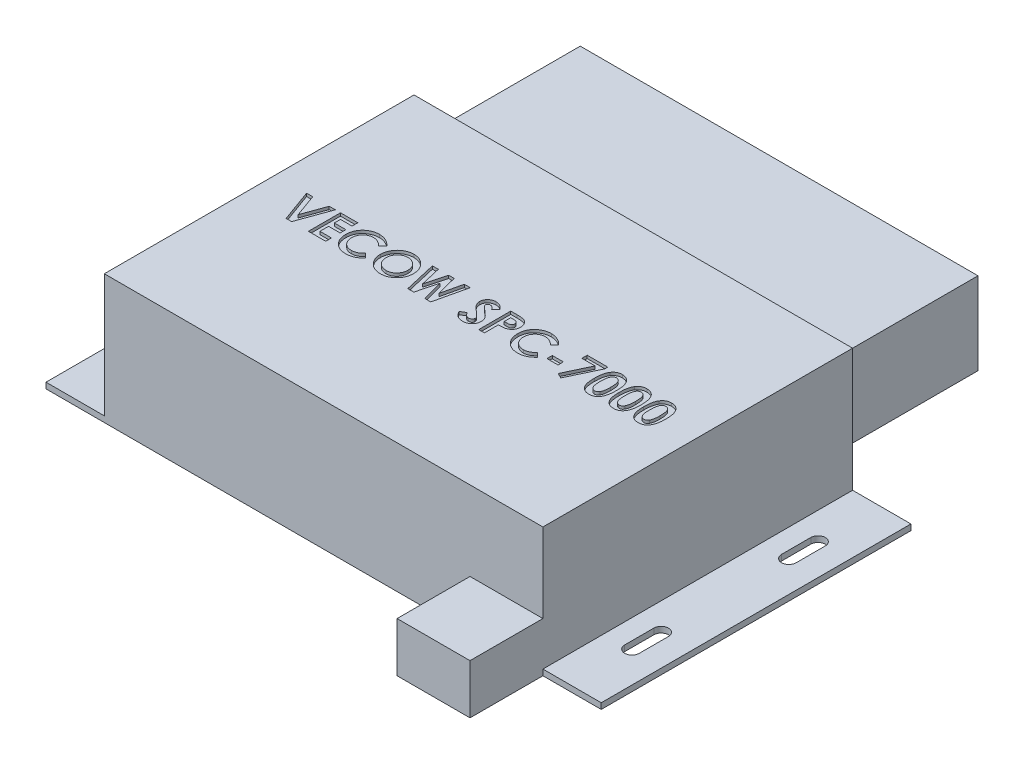
from build123d import *

# Parameters (mm, degrees)
SKETCH1_W           = 150.4
SKETCH1_H           = 106.2
BOSS_EXTRUDE1_DEPTH = 44.2
SKETCH2_W           = 106.2
SKETCH2_H           = 2
BOSS_EXTRUDE2_DEPTH = 20
CUT_EXTRUDE1_DEPTH  = 20
SKETCH4_W           = 3.807692308
SKETCH4_H           = 1.833333333
CUT_EXTRUDE2_DEPTH  = 1
SKETCH5_W           = 136.4
SKETCH5_H           = 28.2
BOSS_EXTRUDE3_DEPTH = 50
SKETCH6_W           = 25
SKETCH6_H           = 17
BOSS_EXTRUDE4_DEPTH = 25


with BuildPart() as part:
    # Sketch1 → Boss-Extrude1 (new body)
    with BuildSketch(Plane(origin=(0, 0, 0), x_dir=(1, 0, 0), z_dir=(0, 1, 0))):
        Rectangle(SKETCH1_W, SKETCH1_H)
    extrude(amount=BOSS_EXTRUDE1_DEPTH)

    # Sketch2 → Boss-Extrude2 (add)
    with BuildSketch(Plane(origin=(75.2, 0, 0), x_dir=(0, 0, -1), z_dir=(1, 0, 0))):
        with Locations((0, 1)):
            Rectangle(SKETCH2_W, SKETCH2_H)
    boss_extrude2 = extrude(amount=BOSS_EXTRUDE2_DEPTH)

    # Mirror1: Boss-Extrude2 across plane
    add(boss_extrude2.mirror(Plane(origin=(0, 0, 0), x_dir=(0, 0, 1), z_dir=(1, 0, 0))))

    # Sketch3 → Cut-Extrude1 (cut)
    with BuildSketch(Plane.XZ):
        with BuildLine():
            Line((-82.05, 31.9), (-82.05, 21.9))
            ThreePointArc((-82.05, 21.9), (-84.55, 19.4), (-87.05, 21.9))
            Line((-87.05, 21.9), (-87.05, 31.9))
            ThreePointArc((-87.05, 31.9), (-84.55, 34.4), (-82.05, 31.9))
        make_face()
        with BuildLine():
            Line((-82.05, -21.9), (-82.05, -31.9))
            ThreePointArc((-82.05, -31.9), (-84.55, -34.4), (-87.05, -31.9))
            Line((-87.05, -31.9), (-87.05, -21.9))
            ThreePointArc((-87.05, -21.9), (-84.55, -19.4), (-82.05, -21.9))
        make_face()
        with BuildLine():
            Line((87.05, 31.9), (87.05, 21.9))
            ThreePointArc((87.05, 21.9), (84.55, 19.4), (82.05, 21.9))
            Line((82.05, 21.9), (82.05, 31.9))
            ThreePointArc((82.05, 31.9), (84.55, 34.4), (87.05, 31.9))
        make_face()
        with BuildLine():
            Line((87.05, -21.9), (87.05, -31.9))
            ThreePointArc((87.05, -31.9), (84.55, -34.4), (82.05, -31.9))
            Line((82.05, -31.9), (82.05, -21.9))
            ThreePointArc((82.05, -21.9), (84.55, -19.4), (87.05, -21.9))
        make_face()
    extrude(amount=-CUT_EXTRUDE1_DEPTH, mode=Mode.SUBTRACT)

    # Sketch4 → Cut-Extrude2 (cut)
    # profile 1 of 13: a face of its own
    with BuildSketch(Plane(origin=(0, 44.2, 0), x_dir=(1, 0, 0), z_dir=(0, 1, 0))):
        Polygon((-64.448717949, 5.5), (-62.33994391, 5.5), (-59.512820513, -2.313701923), (-56.679086538, 5.5), (-54.576923077, 5.5), (-58.565304487, -5.5), (-60.466947115, -5.5), align=None)
    # profile 2 of 13: a face of its own
    with BuildSketch(Plane(origin=(0, 44.2, 0), x_dir=(1, 0, 0), z_dir=(0, 1, 0))):
        Polygon((-52.814102564, 5.5), (-46.891025641, 5.5), (-46.891025641, 3.525641026), (-50.83974359, 3.525641026), (-50.83974359, 1.41025641), (-46.891025641, 1.41025641), (-46.891025641, -0.564102564), (-50.83974359, -0.564102564), (-50.83974359, -3.525641026), (-46.891025641, -3.525641026), (-46.891025641, -5.5), (-52.814102564, -5.5), align=None)
    # profile 3 of 13: a face of its own
    with BuildSketch(Plane(origin=(0, 44.2, 0), x_dir=(1, 0, 0), z_dir=(0, 1, 0))):
        with BuildLine():
            Line((-35.044871795, 3.591746795), (-36.492588141, 2.207932692))
            add(Edge.make_bspline(
                [(-36.492588141, 2.207932692), (-36.615395236, 2.334915434), (-36.855275966, 2.582952511), (-37.241814096, 2.911331743), (-37.643799677, 3.184991401), (-38.053412882, 3.415465822), (-38.478021466, 3.589836148), (-38.912715796, 3.716902742), (-39.360271524, 3.794370441), (-39.663160026, 3.803234117), (-39.815504808, 3.807692308)],
                knots=[0, 0, 0, 0, 1.115251505, 2.178435587, 3.19620269, 4.182487026, 5.141301733, 6.088180966, 7.038406374, 8, 8, 8, 8], degree=3))
            add(Edge.make_bspline(
                [(-39.815504808, 3.807692308), (-39.942731214, 3.804170181), (-40.193798509, 3.797219652), (-40.56243109, 3.74626542), (-40.915047205, 3.659615531), (-41.252853916, 3.540195934), (-41.57485721, 3.385673312), (-41.881732208, 3.196167264), (-42.172722323, 2.973389298), (-42.443983744, 2.718492077), (-42.692124158, 2.439997709), (-42.911372014, 2.142844883), (-43.095027263, 1.827714358), (-43.245750138, 1.497797546), (-43.363157431, 1.151567429), (-43.44700099, 0.789257101), (-43.495493863, 0.41043508), (-43.50273175, 0.152914693), (-43.506410256, 0.022035256)],
                knots=[0, 0, 0, 0, 1.035432265, 2.043311493, 3.022114605, 3.98653278, 4.95457646, 5.923598177, 6.917315552, 7.932509744, 8.948865224, 9.949768934, 10.933144597, 11.912367597, 12.897413939, 13.903909035, 14.934704909, 16, 16, 16, 16], degree=3))
            add(Edge.make_bspline(
                [(-43.506410256, 0.022035256), (-43.505350153, -0.069825089), (-43.503260667, -0.250883719), (-43.480387545, -0.518719682), (-43.443556427, -0.778583886), (-43.390252673, -1.030082705), (-43.323595804, -1.273434091), (-43.24539212, -1.510737424), (-43.147286749, -1.738713706), (-43.038388306, -1.960010733), (-42.911740672, -2.168590139), (-42.77519116, -2.367487913), (-42.627125507, -2.555729078), (-42.466584685, -2.732544099), (-42.291309281, -2.895169753), (-42.105829515, -3.048496386), (-41.907016601, -3.188685713), (-41.699000387, -3.319255941), (-41.479983875, -3.432683409), (-41.255909491, -3.535426781), (-41.023379816, -3.618869676), (-40.785226039, -3.686132261), (-40.542299237, -3.743329044), (-40.29222336, -3.778546861), (-40.037166253, -3.805216901), (-39.86479046, -3.80686362), (-39.778044872, -3.807692308)],
                knots=[0, 0, 0, 0, 1.103660481, 2.175337485, 3.227646561, 4.255952547, 5.262355991, 6.258840057, 7.255597736, 8.242457506, 9.22035537, 10.185017736, 11.140346927, 12.096287581, 13.051739095, 14.01125915, 14.986044842, 15.97314143, 16.960198552, 17.947847494, 18.933482797, 19.925264591, 20.920966487, 21.929612487, 22.958107872, 24, 24, 24, 24], degree=3))
            add(Edge.make_bspline(
                [(-39.778044872, -3.807692308), (-39.630909447, -3.80343637), (-39.341826599, -3.79507456), (-38.917555952, -3.72968639), (-38.513268294, -3.622126549), (-38.190244389, -3.495104628), (-37.937163692, -3.369668831), (-37.744497099, -3.253646896), (-37.545264825, -3.123863624), (-37.342775949, -2.975420852), (-37.134752871, -2.810099954), (-36.924867679, -2.624280094), (-36.707747276, -2.424080053), (-36.565513851, -2.28119335), (-36.492588141, -2.207932692)],
                knots=[0, 0, 0, 0, 1.404581149, 2.759636711, 4.088442092, 5.392261763, 6.066678138, 6.783632037, 7.538459478, 8.336747902, 9.180226004, 10.074962426, 11.012997595, 12, 12, 12, 12], degree=3))
            Line((-36.492588141, -2.207932692), (-35.088942308, -3.682091346))
            add(Edge.make_bspline(
                [(-35.088942308, -3.682091346), (-35.187611055, -3.777352924), (-35.380191347, -3.96328315), (-35.670693373, -4.227286723), (-35.96082979, -4.46452328), (-36.243591508, -4.683603471), (-36.523610458, -4.878144956), (-36.800856944, -5.048342027), (-37.072192415, -5.198499214), (-37.34325124, -5.326084189), (-37.615720086, -5.434417085), (-37.896058509, -5.527684597), (-38.185123529, -5.606585556), (-38.484680625, -5.670248269), (-38.791935711, -5.72129717), (-39.109764285, -5.755754883), (-39.436151157, -5.778919656), (-39.657544429, -5.781001203), (-39.769230769, -5.782051282)],
                knots=[0, 0, 0, 0, 1.244526981, 2.429050516, 3.560637417, 4.644440555, 5.67424972, 6.652764056, 7.595344123, 8.486817594, 9.369275933, 10.254498637, 11.166417451, 12.086725134, 13.032340136, 13.991389299, 14.986715468, 16, 16, 16, 16], degree=3))
            add(Edge.make_bspline(
                [(-39.769230769, -5.782051282), (-39.974384742, -5.776821498), (-40.37581404, -5.766588265), (-40.964098209, -5.690766934), (-41.522952379, -5.563653809), (-42.053736136, -5.383880789), (-42.556280703, -5.154229181), (-43.030457516, -4.872687094), (-43.475502305, -4.54000254), (-43.887819985, -4.160074905), (-44.260780949, -3.740476727), (-44.590435251, -3.289943397), (-44.863125301, -2.806260707), (-45.089545726, -2.296574198), (-45.266603521, -1.75855797), (-45.391222192, -1.191630055), (-45.468073617, -0.596337857), (-45.476481272, -0.189739563), (-45.480769231, 0.017628205)],
                knots=[0, 0, 0, 0, 1.078019885, 2.10938526, 3.111377082, 4.085535484, 5.04941344, 6.010039228, 6.978205633, 7.964457913, 8.951525778, 9.924444315, 10.892603023, 11.863865945, 12.85144698, 13.863884204, 14.910567087, 16, 16, 16, 16], degree=3))
            add(Edge.make_bspline(
                [(-45.480769231, 0.017628205), (-45.478957347, 0.152871694), (-45.475366637, 0.420891234), (-45.43762794, 0.815705731), (-45.385018001, 1.200579245), (-45.301557117, 1.571515511), (-45.200953253, 1.933511728), (-45.075839131, 2.282633417), (-44.926414574, 2.61988399), (-44.757495889, 2.945828025), (-44.56639987, 3.258330239), (-44.352924639, 3.554705746), (-44.122565879, 3.83724251), (-43.869788447, 4.102192156), (-43.598265528, 4.351880994), (-43.306771228, 4.584955911), (-42.99705874, 4.804759466), (-42.668289787, 5.005623459), (-42.326851474, 5.187315616), (-41.977050236, 5.347575858), (-41.619745495, 5.481516516), (-41.256447967, 5.59261535), (-40.885622725, 5.675542775), (-40.509916625, 5.73831616), (-40.12613286, 5.773406884), (-39.868455309, 5.779151459), (-39.73838141, 5.782051282)],
                knots=[0, 0, 0, 0, 1.071919942, 2.124283339, 3.142214191, 4.149696895, 5.136002878, 6.119640489, 7.086990633, 8.058538607, 9.028339693, 9.988281803, 10.952401235, 11.916291999, 12.888973767, 13.874849856, 14.873389453, 15.898127285, 16.927174885, 17.938320013, 18.946391617, 19.950418109, 20.947802303, 21.956882652, 22.968648068, 24, 24, 24, 24], degree=3))
            add(Edge.make_bspline(
                [(-39.73838141, 5.782051282), (-39.627415038, 5.780389031), (-39.406636033, 5.777081812), (-39.077859048, 5.749512542), (-38.751711467, 5.706215282), (-38.429360999, 5.640888938), (-38.108501864, 5.563338311), (-37.79335051, 5.461796463), (-37.478935254, 5.348608938), (-37.170187233, 5.213316364), (-36.866675479, 5.065632298), (-36.575510235, 4.898079361), (-36.291802861, 4.720968575), (-36.021840143, 4.523817748), (-35.760565098, 4.313777905), (-35.509343957, 4.089869094), (-35.270381331, 3.848358097), (-35.120421655, 3.677716321), (-35.044871795, 3.591746795)],
                knots=[0, 0, 0, 0, 0.996412454, 1.982464992, 2.961075852, 3.949442424, 4.934965278, 5.923860011, 6.921385422, 7.934793307, 8.949617135, 9.951082467, 10.950285876, 11.951772932, 12.951063433, 13.960125323, 14.972308753, 16, 16, 16, 16], degree=3))
        make_face()
    # profile 4 of 13: a face of its own
    with BuildSketch(Plane(origin=(0, 44.2, 0), x_dir=(1, 0, 0), z_dir=(0, 1, 0))):
        with BuildLine():
            add(Edge.make_bspline(
                [(-27.901041667, 5.782051282), (-27.709793185, 5.777099516), (-27.332225367, 5.767323609), (-26.776959355, 5.685833795), (-26.241857885, 5.553057825), (-25.727162927, 5.368489624), (-25.234163219, 5.127130145), (-24.761119785, 4.83582209), (-24.309727044, 4.489067192), (-23.884610508, 4.094954672), (-23.491726158, 3.666374516), (-23.151291639, 3.204931782), (-22.86098157, 2.722582915), (-22.620371808, 2.218035447), (-22.437102689, 1.687795147), (-22.308495169, 1.134565539), (-22.225871208, 0.558504013), (-22.216368181, 0.166284631), (-22.211538462, -0.033052885)],
                knots=[0, 0, 0, 0, 1.014329547, 2.002516266, 2.970391464, 3.935626869, 4.897733899, 5.877609409, 6.878433252, 7.912639331, 8.949961323, 9.958554974, 10.949718813, 11.932905612, 12.9188844, 13.919928257, 14.942845884, 16, 16, 16, 16], degree=3))
            add(Edge.make_bspline(
                [(-22.211538462, -0.033052885), (-22.216681904, -0.230144327), (-22.226817223, -0.618519338), (-22.305122097, -1.18927223), (-22.435895385, -1.736575596), (-22.616056115, -2.261668269), (-22.852302125, -2.762006879), (-23.136950832, -3.24078602), (-23.477513572, -3.693562506), (-23.861568687, -4.12009336), (-24.284380038, -4.507261634), (-24.732204379, -4.848453007), (-25.202973934, -5.1375657), (-25.695999647, -5.374467287), (-26.212338788, -5.558317884), (-26.750715935, -5.688037839), (-27.311097775, -5.766871275), (-27.692184601, -5.776940391), (-27.885616987, -5.782051282)],
                knots=[0, 0, 0, 0, 1.051557043, 2.072126891, 3.067553643, 4.050577992, 5.02905126, 6.015227836, 7.017913613, 8.04756643, 9.074058332, 10.072836633, 11.047628519, 12.017157415, 12.98668631, 13.966869689, 14.968021931, 16, 16, 16, 16], degree=3))
            add(Edge.make_bspline(
                [(-27.885616987, -5.782051282), (-28.087924069, -5.777466561), (-28.485429833, -5.768458211), (-29.067181298, -5.682792916), (-29.624549469, -5.553751057), (-30.152852132, -5.361163004), (-30.657469599, -5.120411744), (-31.134694296, -4.823912134), (-31.584365846, -4.472154161), (-32.003904858, -4.074146479), (-32.384008219, -3.638638778), (-32.719523992, -3.178563512), (-33.00253899, -2.697435252), (-33.233063567, -2.19502882), (-33.414799883, -1.674466549), (-33.542994205, -1.132578064), (-33.61872165, -0.570663012), (-33.629270044, -0.188999076), (-33.634615385, 0.004407051)],
                knots=[0, 0, 0, 0, 1.067978421, 2.098431617, 3.099715153, 4.085208694, 5.062210972, 6.048429807, 7.046490867, 8.072918869, 9.098532598, 10.095778865, 11.076610158, 12.041847152, 13.011192615, 13.984257998, 14.978533688, 16, 16, 16, 16], degree=3))
            add(Edge.make_bspline(
                [(-33.634615385, 0.004407051), (-33.632937709, 0.134520569), (-33.6296036, 0.393100068), (-33.589440749, 0.776301686), (-33.53161779, 1.152023723), (-33.446100377, 1.51876817), (-33.342218579, 1.879122238), (-33.207625034, 2.229731663), (-33.054421156, 2.574341916), (-32.875416849, 2.90888272), (-32.676381368, 3.23027602), (-32.459215938, 3.537005747), (-32.223374498, 3.825363091), (-31.969616774, 4.097243016), (-31.69706828, 4.350858438), (-31.409314111, 4.589799634), (-31.100773511, 4.807719478), (-30.778199467, 5.009940006), (-30.443410576, 5.192804523), (-30.097769733, 5.348453331), (-29.748397822, 5.484378783), (-29.390627705, 5.59165716), (-29.028293527, 5.679034276), (-28.657524479, 5.736818263), (-28.28167025, 5.776980002), (-28.028218964, 5.780356844), (-27.901041667, 5.782051282)],
                knots=[0, 0, 0, 0, 1.034744296, 2.056386356, 3.06226378, 4.057406941, 5.050368692, 6.043467995, 7.042652155, 8.049140477, 9.059438543, 10.048523776, 11.036952808, 12.020949711, 13.004946614, 13.997082645, 14.994316842, 16.007702937, 17.024872941, 18.026463647, 19.021641123, 20.005082605, 20.995858141, 21.984425357, 22.988620895, 24, 24, 24, 24], degree=3))
        make_face()
        with BuildLine():
            add(Edge.make_bspline(
                [(-27.931891026, 3.807692308), (-28.060601228, 3.804238724), (-28.314623663, 3.797422732), (-28.687228313, 3.745494089), (-29.044941936, 3.662558145), (-29.385781583, 3.542426444), (-29.711224483, 3.389529277), (-30.021847546, 3.204400887), (-30.313349284, 2.980677691), (-30.589616592, 2.730370391), (-30.839178644, 2.451470535), (-31.05967459, 2.152581907), (-31.244194182, 1.834203647), (-31.398730496, 1.499293413), (-31.51506209, 1.144085228), (-31.597921597, 0.771361477), (-31.650285712, 0.380479937), (-31.656886274, 0.114016501), (-31.66025641, -0.022035256)],
                knots=[0, 0, 0, 0, 1.033739768, 2.040188636, 3.016340934, 3.979330865, 4.937572243, 5.900995986, 6.878200029, 7.884839167, 8.891893314, 9.879764717, 10.863503415, 11.843163062, 12.837761627, 13.859916423, 14.907309254, 16, 16, 16, 16], degree=3))
            add(Edge.make_bspline(
                [(-31.66025641, -0.022035256), (-31.655788124, -0.172811208), (-31.647031024, -0.46830709), (-31.585415004, -0.899368522), (-31.479996127, -1.306463262), (-31.327773318, -1.68760027), (-31.138977098, -2.047011787), (-30.904522158, -2.380292714), (-30.628205556, -2.689438582), (-30.415333485, -2.869930817), (-30.307291667, -2.961538462)],
                knots=[0, 0, 0, 0, 1.078454662, 2.113592447, 3.107694534, 4.079536787, 5.043276885, 6.005368276, 6.987637804, 8, 8, 8, 8], degree=3))
            add(Edge.make_bspline(
                [(-30.307291667, -2.961538462), (-30.218784791, -3.029214671), (-30.043765116, -3.163042334), (-29.764395608, -3.334569938), (-29.476700026, -3.481586206), (-29.178507345, -3.600373611), (-28.870447333, -3.693809787), (-28.552562235, -3.759241605), (-28.225302466, -3.800305729), (-28.003994073, -3.80521367), (-27.892227564, -3.807692308)],
                knots=[0, 0, 0, 0, 1.023928204, 2.024787132, 3.009472467, 3.9914905, 4.972207045, 5.96565515, 6.972602802, 8, 8, 8, 8], degree=3))
            add(Edge.make_bspline(
                [(-27.892227564, -3.807692308), (-27.765730537, -3.804209441), (-27.516843657, -3.797356792), (-27.151175243, -3.74606742), (-26.800853797, -3.659267284), (-26.463704493, -3.540189421), (-26.140699519, -3.385372498), (-25.833417487, -3.194502005), (-25.54131965, -2.969921588), (-25.265404304, -2.716327205), (-25.013204634, -2.436328676), (-24.793168818, -2.135845807), (-24.602782425, -1.821499135), (-24.451459696, -1.48883956), (-24.330532103, -1.141007231), (-24.248669853, -0.776461676), (-24.19586338, -0.396705688), (-24.189260958, -0.138268318), (-24.185897436, -0.006610577)],
                knots=[0, 0, 0, 0, 1.026359118, 2.019393844, 2.989460624, 3.950973911, 4.916101784, 5.890408035, 6.881132271, 7.902007068, 8.92769091, 9.933912415, 10.920395702, 11.90457117, 12.894218921, 13.903490204, 14.931958862, 16, 16, 16, 16], degree=3))
            add(Edge.make_bspline(
                [(-24.185897436, -0.006610577), (-24.189377337, 0.124290095), (-24.196226991, 0.381948105), (-24.247606635, 0.760727743), (-24.333856307, 1.123663937), (-24.453291749, 1.4713494), (-24.605804484, 1.804124994), (-24.794401953, 2.120820481), (-25.018422391, 2.421129696), (-25.272709981, 2.703006146), (-25.549486393, 2.962032547), (-25.846633528, 3.186820378), (-26.155836873, 3.382153855), (-26.484191063, 3.535170214), (-26.824978246, 3.657078022), (-27.180277923, 3.746852682), (-27.551435813, 3.79705793), (-27.8039422, 3.804115918), (-27.931891026, 3.807692308)],
                knots=[0, 0, 0, 0, 1.055025985, 2.07665775, 3.074803781, 4.057872707, 5.035505728, 6.020516407, 7.023567878, 8.050795229, 9.077271434, 10.074415901, 11.050397877, 12.019801805, 12.988065821, 13.964604439, 14.968634123, 16, 16, 16, 16], degree=3))
        make_face(mode=Mode.SUBTRACT)
    # profile 5 of 13: a face of its own
    with BuildSketch(Plane(origin=(0, 44.2, 0), x_dir=(1, 0, 0), z_dir=(0, 1, 0))):
        Polygon((-21.294871795, 5.5), (-19.256610577, 5.5), (-17.628205128, -1.522636218), (-15.76181891, 5.5), (-13.842548077, 5.5), (-11.987179487, -1.522636218), (-10.36318109, 5.5), (-8.320512821, 5.5), (-10.865584936, -5.5), (-12.928084936, -5.5), (-14.807692308, 1.610777244), (-16.698317308, -5.5), (-18.745392628, -5.5), align=None)
    # profile 6 of 13: a face of its own
    with BuildSketch(Plane(origin=(0, 44.2, 0), x_dir=(1, 0, 0), z_dir=(0, 1, 0))):
        with BuildLine():
            Line((3.314102564, 4.030248397), (1.837740385, 2.679487179))
            add(Edge.make_bspline(
                [(1.837740385, 2.679487179), (1.774499359, 2.76869522), (1.65308541, 2.939962218), (1.456286062, 3.169292765), (1.260375364, 3.364928788), (1.063538323, 3.52605301), (0.864030249, 3.651686482), (0.66219746, 3.740636368), (0.459184202, 3.797182654), (0.322790631, 3.804224028), (0.255608974, 3.807692308)],
                knots=[0, 0, 0, 0, 1.299362458, 2.494594718, 3.587462134, 4.587049575, 5.512617175, 6.380583204, 7.202344345, 8, 8, 8, 8], degree=3))
            add(Edge.make_bspline(
                [(0.255608974, 3.807692308), (0.192943852, 3.805494646), (0.071953965, 3.80125154), (-0.100526096, 3.759075374), (-0.25365635, 3.686285507), (-0.387287349, 3.591106632), (-0.493142816, 3.476438153), (-0.577660197, 3.356180403), (-0.625250585, 3.223443044), (-0.631514417, 3.132273671), (-0.634615385, 3.087139423)],
                knots=[0, 0, 0, 0, 1.185010067, 2.2879431, 3.333075148, 4.379039566, 5.372662701, 6.27520591, 7.14612461, 8, 8, 8, 8], degree=3))
            add(Edge.make_bspline(
                [(-0.634615385, 3.087139423), (-0.632672165, 3.041354319), (-0.628758791, 2.949149483), (-0.590960925, 2.814011813), (-0.533988747, 2.681966577), (-0.479549506, 2.601584359), (-0.451722756, 2.560496795)],
                knots=[0, 0, 0, 0, 0.967525499, 1.948461899, 2.951351359, 4, 4, 4, 4], degree=3))
            add(Edge.make_bspline(
                [(-0.451722756, 2.560496795), (-0.426425231, 2.528559861), (-0.368193669, 2.455045257), (-0.257158006, 2.338609584), (-0.117720532, 2.195965693), (0.055484599, 2.032018689), (0.255267167, 1.840872397), (0.490887351, 1.630040849), (0.755562975, 1.39299484), (0.943688277, 1.227924582), (1.042267628, 1.141426282)],
                knots=[0, 0, 0, 0, 0.473873513, 1.090794244, 1.870441696, 2.795289791, 3.865433203, 5.087734844, 6.473946851, 8, 8, 8, 8], degree=3))
            add(Edge.make_bspline(
                [(1.042267628, 1.141426282), (1.13479853, 1.061345454), (1.310402957, 0.90936868), (1.560253185, 0.693662051), (1.779829923, 0.499596056), (1.972331903, 0.330083211), (2.134840983, 0.183344938), (2.268040353, 0.05867983), (2.373556815, -0.041485113), (2.433536746, -0.1019848), (2.459134615, -0.127804487)],
                knots=[0, 0, 0, 0, 1.543621617, 2.929473131, 4.163658386, 5.240097082, 6.164993805, 6.925417477, 7.541396219, 8, 8, 8, 8], degree=3))
            add(Edge.make_bspline(
                [(2.459134615, -0.127804487), (2.556247595, -0.23290153), (2.742932847, -0.434934954), (2.985557863, -0.748023224), (3.1852461, -1.053661215), (3.339728706, -1.357600003), (3.456400184, -1.664224818), (3.538655121, -1.981055618), (3.587918151, -2.311403086), (3.593387497, -2.536824905), (3.596153846, -2.650841346)],
                knots=[0, 0, 0, 0, 1.206664779, 2.319633467, 3.337109185, 4.282041471, 5.190008762, 6.099243693, 7.03861361, 8, 8, 8, 8], degree=3))
            add(Edge.make_bspline(
                [(3.596153846, -2.650841346), (3.59418483, -2.761936385), (3.590321546, -2.979908986), (3.543003734, -3.298879419), (3.47553131, -3.604147967), (3.371207107, -3.892392876), (3.244057385, -4.1683456), (3.084656845, -4.427707671), (2.897462768, -4.67310394), (2.682909613, -4.900147649), (2.445588347, -5.106174078), (2.191038735, -5.289583671), (1.916771662, -5.441011652), (1.625130423, -5.565701793), (1.316271127, -5.661739808), (0.990561718, -5.732720851), (0.647504002, -5.775322554), (0.412916192, -5.779776056), (0.29306891, -5.782051282)],
                knots=[0, 0, 0, 0, 1.043214005, 2.046824704, 3.02475056, 3.976699089, 4.921714032, 5.875962561, 6.831408892, 7.817874052, 8.806269674, 9.781291748, 10.760897367, 11.74438705, 12.757449933, 13.795994037, 14.874007457, 16, 16, 16, 16], degree=3))
            add(Edge.make_bspline(
                [(0.29306891, -5.782051282), (0.198989814, -5.780382256), (0.01265925, -5.777076628), (-0.261963832, -5.750088924), (-0.527143461, -5.706533641), (-0.782580938, -5.64410591), (-1.029427053, -5.565001507), (-1.267691943, -5.46837851), (-1.495730787, -5.352739298), (-1.715269035, -5.220461872), (-1.92523946, -5.066870357), (-2.128297056, -4.895104881), (-2.322424861, -4.702523613), (-2.508555232, -4.489582001), (-2.685497255, -4.255677046), (-2.859042878, -4.004066307), (-3.021479211, -3.73008023), (-3.12182336, -3.537876781), (-3.173076923, -3.439703526)],
                knots=[0, 0, 0, 0, 1.016823716, 2.013894106, 2.979844003, 3.91962641, 4.853723003, 5.779685073, 6.695824784, 7.614987388, 8.547259901, 9.504950863, 10.487499108, 11.500346958, 12.559593716, 13.656357062, 14.802919212, 16, 16, 16, 16], degree=3))
            Line((-3.173076923, -3.439703526), (-1.436698718, -2.397435897))
            add(Edge.make_bspline(
                [(-1.436698718, -2.397435897), (-1.37258817, -2.508875369), (-1.249682771, -2.722514361), (-1.041408082, -3.009565424), (-0.828041296, -3.255377144), (-0.604649564, -3.455604782), (-0.373949245, -3.61292564), (-0.134826004, -3.72535804), (0.112888162, -3.794953568), (0.281619799, -3.803452789), (0.365785256, -3.807692308)],
                knots=[0, 0, 0, 0, 1.283663364, 2.460892379, 3.537111102, 4.529833553, 5.449777664, 6.316464042, 7.160231139, 8, 8, 8, 8], degree=3))
            add(Edge.make_bspline(
                [(0.365785256, -3.807692308), (0.451393577, -3.804230087), (0.617486186, -3.797512875), (0.854562131, -3.735468013), (1.071922335, -3.638053027), (1.259806889, -3.499055276), (1.418895684, -3.338630745), (1.536312346, -3.160151119), (1.610074285, -2.967040472), (1.617872711, -2.832893114), (1.621794872, -2.765424679)],
                knots=[0, 0, 0, 0, 1.13588714, 2.203786484, 3.234766741, 4.283437687, 5.291419208, 6.222934724, 7.106237994, 8, 8, 8, 8], degree=3))
            add(Edge.make_bspline(
                [(1.621794872, -2.765424679), (1.618172917, -2.702656281), (1.610815261, -2.575148287), (1.55662104, -2.385564404), (1.471898942, -2.196066741), (1.371666726, -2.04063563), (1.269667896, -1.910497374), (1.172134008, -1.797738463), (1.053363533, -1.673159606), (0.913657621, -1.536604093), (0.754862152, -1.386869792), (0.57684336, -1.223971364), (0.377562743, -1.04934375), (0.23671081, -0.930389145), (0.163060897, -0.868189103)],
                knots=[0, 0, 0, 0, 0.916159276, 1.861089862, 2.860218735, 3.940849679, 4.552606315, 5.27541173, 6.11797699, 7.06649574, 8.129236253, 9.306560635, 10.591630461, 12, 12, 12, 12], degree=3))
            add(Edge.make_bspline(
                [(0.163060897, -0.868189103), (0.023049483, -0.74972602), (-0.2456748, -0.522359508), (-0.625416304, -0.186546328), (-0.967597402, 0.127301859), (-1.269262648, 0.423064902), (-1.534255726, 0.695280745), (-1.760781987, 0.946160427), (-1.946352936, 1.177639143), (-2.141626346, 1.451810191), (-2.327175128, 1.785906452), (-2.48754193, 2.187862985), (-2.591581142, 2.589768516), (-2.603237289, 2.859585752), (-2.608974359, 2.992387821)],
                knots=[0, 0, 0, 0, 1.345494975, 2.582412109, 3.71882943, 4.751509156, 5.681369928, 6.505683931, 7.230279997, 7.856715994, 8.973648664, 10.023341002, 11.027102913, 12, 12, 12, 12], degree=3))
            add(Edge.make_bspline(
                [(-2.608974359, 2.992387821), (-2.606588319, 3.086563919), (-2.601887564, 3.272100951), (-2.559956107, 3.544906121), (-2.497287947, 3.808140189), (-2.406275786, 4.060842756), (-2.288152991, 4.302697302), (-2.144697445, 4.534887807), (-1.973681554, 4.755277242), (-1.780958191, 4.963719504), (-1.568626388, 5.154212011), (-1.341722872, 5.322340736), (-1.101531939, 5.464344701), (-0.849522953, 5.582147302), (-0.584134322, 5.67231771), (-0.30732115, 5.736234989), (-0.018686399, 5.774250948), (0.177636728, 5.779418777), (0.277644231, 5.782051282)],
                knots=[0, 0, 0, 0, 1.010766082, 1.991317756, 2.957454644, 3.913069143, 4.869106762, 5.843196583, 6.838735724, 7.860187025, 8.887984031, 9.89767229, 10.887916223, 11.879572884, 12.879850636, 13.892031539, 14.926195476, 16, 16, 16, 16], degree=3))
            add(Edge.make_bspline(
                [(0.277644231, 5.782051282), (0.407249005, 5.777310063), (0.665435498, 5.767865051), (1.047171675, 5.694008144), (1.420035612, 5.577860377), (1.72049636, 5.437740875), (1.959567369, 5.302007047), (2.142792965, 5.177040437), (2.329234872, 5.033884467), (2.520396627, 4.872088018), (2.712726149, 4.68860263), (2.911692287, 4.487796318), (3.114583883, 4.267933646), (3.246431251, 4.110864772), (3.314102564, 4.030248397)],
                knots=[0, 0, 0, 0, 1.282922637, 2.555718331, 3.837320111, 5.142675274, 5.830281639, 6.55870424, 7.337177975, 8.157850921, 9.037902056, 9.96903443, 10.957596896, 12, 12, 12, 12], degree=3))
        make_face()
    # profile 7 of 13: a face of its own
    with BuildSketch(Plane(origin=(0, 44.2, 0), x_dir=(1, 0, 0), z_dir=(0, 1, 0))):
        with BuildLine():
            Line((5.570512821, 5.5), (7.774038462, 5.5))
            add(Edge.make_bspline(
                [(7.774038462, 5.5), (7.918013968, 5.499355535), (8.1957729, 5.498112227), (8.596324132, 5.483035462), (8.965852255, 5.456016982), (9.304272372, 5.422626413), (9.611445331, 5.375814135), (9.887755807, 5.322147523), (10.133261139, 5.25676597), (10.350729766, 5.179158973), (10.545900834, 5.087663356), (10.730595613, 4.990213992), (10.90063998, 4.873911614), (11.064616588, 4.751290797), (11.213150613, 4.610637622), (11.355508495, 4.461312763), (11.485660989, 4.297394117), (11.604211175, 4.120865875), (11.711754461, 3.934989526), (11.80571147, 3.739432777), (11.881924134, 3.53388618), (11.945857082, 3.319679388), (11.99720865, 3.096821736), (12.031389887, 2.863942631), (12.054607504, 2.622668122), (12.056656138, 2.458456539), (12.057692308, 2.375400641)],
                knots=[0, 0, 0, 0, 1.698747864, 3.27724071, 4.728299578, 6.070144658, 7.288476769, 8.393259625, 9.389771311, 10.283485332, 11.113357557, 11.931608583, 12.74405601, 13.541433047, 14.344816069, 15.154114104, 15.974336324, 16.810834471, 17.661136416, 18.50621059, 19.367396281, 20.244825668, 21.142564693, 22.063065223, 23.020325768, 24, 24, 24, 24], degree=3))
            add(Edge.make_bspline(
                [(12.057692308, 2.375400641), (12.056193099, 2.283517879), (12.05324697, 2.102956961), (12.024365413, 1.838276807), (11.975026589, 1.585928243), (11.910543326, 1.343783171), (11.820626002, 1.115825411), (11.717899682, 0.896615824), (11.591513724, 0.692300371), (11.447097563, 0.500323314), (11.289378639, 0.319123788), (11.114612712, 0.153933587), (10.926130895, 0.003626614), (10.725024244, -0.133372358), (10.510537741, -0.256786973), (10.282826152, -0.367772877), (10.04033453, -0.462780397), (9.871470661, -0.512468561), (9.785857372, -0.537660256)],
                knots=[0, 0, 0, 0, 1.102006807, 2.165578795, 3.188629044, 4.184801286, 5.166646146, 6.124351954, 7.085497154, 8.042432466, 9.003981491, 9.963833307, 10.922997304, 11.89326795, 12.880200226, 13.889073926, 14.929769137, 16, 16, 16, 16], degree=3))
            add(Edge.make_bspline(
                [(9.785857372, -0.537660256), (9.729467535, -0.551690139), (9.607308989, -0.582083383), (9.405170148, -0.612940154), (9.172226358, -0.641311058), (8.907724358, -0.665692415), (8.611511657, -0.682266057), (8.283875067, -0.695209334), (7.924666107, -0.704620433), (7.674886401, -0.70495438), (7.544871795, -0.705128205)],
                knots=[0, 0, 0, 0, 0.618981996, 1.340914327, 2.176866532, 3.120127938, 4.170906482, 5.338178032, 6.614476169, 8, 8, 8, 8], degree=3))
            Line((7.544871795, -0.705128205), (7.544871795, -5.5))
            Line((7.544871795, -5.5), (5.570512821, -5.5))
            Line((5.570512821, -5.5), (5.570512821, 5.5))
        make_face()
        with BuildLine():
            Line((7.544871795, 1.269230769), (8.243389423, 1.269230769))
            add(Edge.make_bspline(
                [(8.243389423, 1.269230769), (8.370495734, 1.270036722), (8.604373233, 1.271519687), (8.923767308, 1.292964221), (9.18043853, 1.325714356), (9.383213562, 1.372685624), (9.543323655, 1.443970742), (9.681408587, 1.526434201), (9.799847559, 1.63070698), (9.902398275, 1.749856472), (9.984384483, 1.886765211), (10.041237648, 2.039203902), (10.078168345, 2.203969647), (10.081579238, 2.318635699), (10.083333333, 2.377604167)],
                knots=[0, 0, 0, 0, 1.8619151, 3.425951444, 4.686033666, 5.651700536, 6.461346321, 7.243864085, 7.999046032, 8.762387399, 9.539336099, 10.322741239, 11.137448474, 12, 12, 12, 12], degree=3))
            add(Edge.make_bspline(
                [(10.083333333, 2.377604167), (10.081597282, 2.429124149), (10.078228924, 2.529085301), (10.053484053, 2.673354038), (10.014047847, 2.807842263), (9.9569063, 2.931145423), (9.88303581, 3.043054007), (9.792972734, 3.14352393), (9.687872758, 3.234706841), (9.606729432, 3.282971348), (9.565504808, 3.307491987)],
                knots=[0, 0, 0, 0, 1.102301479, 2.1387299, 3.123554645, 4.094223062, 5.036071848, 5.982632524, 6.975082478, 8, 8, 8, 8], degree=3))
            add(Edge.make_bspline(
                [(9.565504808, 3.307491987), (9.530585171, 3.325151849), (9.456653144, 3.362541395), (9.330739735, 3.406009476), (9.185437584, 3.44267959), (9.019765737, 3.473115431), (8.834385107, 3.496736805), (8.629328769, 3.514801246), (8.404294963, 3.522065662), (8.247797416, 3.524416366), (8.166266026, 3.525641026)],
                knots=[0, 0, 0, 0, 0.656809284, 1.390599849, 2.23162475, 3.173112763, 4.218524733, 5.370385145, 6.63003504, 8, 8, 8, 8], degree=3))
            Line((8.166266026, 3.525641026), (7.544871795, 3.525641026))
            Line((7.544871795, 3.525641026), (7.544871795, 1.269230769))
        make_face(mode=Mode.SUBTRACT)
    # profile 8 of 13: a face of its own
    with BuildSketch(Plane(origin=(0, 44.2, 0), x_dir=(1, 0, 0), z_dir=(0, 1, 0))):
        with BuildLine():
            Line((23.903846154, 3.591746795), (22.456129808, 2.207932692))
            add(Edge.make_bspline(
                [(22.456129808, 2.207932692), (22.333322713, 2.334915434), (22.093441983, 2.582952511), (21.706903853, 2.911331743), (21.304918272, 3.184991401), (20.895305067, 3.415465822), (20.470696483, 3.589836148), (20.036002153, 3.716902742), (19.588446425, 3.794370441), (19.285557923, 3.803234117), (19.133213141, 3.807692308)],
                knots=[0, 0, 0, 0, 1.115251505, 2.178435587, 3.19620269, 4.182487026, 5.141301733, 6.088180966, 7.038406374, 8, 8, 8, 8], degree=3))
            add(Edge.make_bspline(
                [(19.133213141, 3.807692308), (19.005986735, 3.804170181), (18.75491944, 3.797219652), (18.386286859, 3.74626542), (18.033670743, 3.659615531), (17.695864033, 3.540195934), (17.373860739, 3.385673312), (17.06698574, 3.196167264), (16.775995626, 2.973389298), (16.504734205, 2.718492077), (16.256593791, 2.439997709), (16.037345935, 2.142844883), (15.853690686, 1.827714358), (15.702967811, 1.497797546), (15.585560517, 1.151567429), (15.501716959, 0.789257101), (15.453224085, 0.41043508), (15.445986199, 0.152914693), (15.442307692, 0.022035256)],
                knots=[0, 0, 0, 0, 1.035432265, 2.043311493, 3.022114605, 3.98653278, 4.95457646, 5.923598177, 6.917315552, 7.932509744, 8.948865224, 9.949768934, 10.933144597, 11.912367597, 12.897413939, 13.903909035, 14.934704909, 16, 16, 16, 16], degree=3))
            add(Edge.make_bspline(
                [(15.442307692, 0.022035256), (15.443367796, -0.069825089), (15.445457282, -0.250883719), (15.468330403, -0.518719682), (15.505161522, -0.778583886), (15.558465276, -1.030082705), (15.625122144, -1.273434091), (15.703325829, -1.510737424), (15.8014312, -1.738713706), (15.910329643, -1.960010733), (16.036977276, -2.168590139), (16.173526789, -2.367487913), (16.321592441, -2.555729078), (16.482133264, -2.732544099), (16.657408668, -2.895169753), (16.842888434, -3.048496386), (17.041701348, -3.188685713), (17.249717562, -3.319255941), (17.468734074, -3.432683409), (17.692808458, -3.535426781), (17.925338132, -3.618869676), (18.16349191, -3.686132261), (18.406418712, -3.743329044), (18.656494589, -3.778546861), (18.911551696, -3.805216901), (19.083927489, -3.80686362), (19.170673077, -3.807692308)],
                knots=[0, 0, 0, 0, 1.103660481, 2.175337485, 3.227646561, 4.255952547, 5.262355991, 6.258840057, 7.255597736, 8.242457506, 9.22035537, 10.185017736, 11.140346927, 12.096287581, 13.051739095, 14.01125915, 14.986044842, 15.97314143, 16.960198552, 17.947847494, 18.933482797, 19.925264591, 20.920966487, 21.929612487, 22.958107872, 24, 24, 24, 24], degree=3))
            add(Edge.make_bspline(
                [(19.170673077, -3.807692308), (19.317808502, -3.80343637), (19.60689135, -3.79507456), (20.031161997, -3.72968639), (20.435449655, -3.622126549), (20.758473559, -3.495104628), (21.011554256, -3.369668831), (21.20422085, -3.253646896), (21.403453123, -3.123863624), (21.605942, -2.975420852), (21.813965078, -2.810099954), (22.023850269, -2.624280094), (22.240970673, -2.424080053), (22.383204098, -2.28119335), (22.456129808, -2.207932692)],
                knots=[0, 0, 0, 0, 1.404581149, 2.759636711, 4.088442092, 5.392261763, 6.066678138, 6.783632037, 7.538459478, 8.336747902, 9.180226004, 10.074962426, 11.012997595, 12, 12, 12, 12], degree=3))
            Line((22.456129808, -2.207932692), (23.859775641, -3.682091346))
            add(Edge.make_bspline(
                [(23.859775641, -3.682091346), (23.761106894, -3.777352924), (23.568526601, -3.96328315), (23.278024576, -4.227286723), (22.987888158, -4.46452328), (22.705126441, -4.683603471), (22.425107491, -4.878144956), (22.147861005, -5.048342027), (21.876525533, -5.198499214), (21.605466709, -5.326084189), (21.332997863, -5.434417085), (21.05265944, -5.527684597), (20.763594419, -5.606585556), (20.464037323, -5.670248269), (20.156782238, -5.72129717), (19.838953664, -5.755754883), (19.512566792, -5.778919656), (19.29117352, -5.781001203), (19.179487179, -5.782051282)],
                knots=[0, 0, 0, 0, 1.244526981, 2.429050516, 3.560637417, 4.644440555, 5.67424972, 6.652764056, 7.595344123, 8.486817594, 9.369275933, 10.254498637, 11.166417451, 12.086725134, 13.032340136, 13.991389299, 14.986715468, 16, 16, 16, 16], degree=3))
            add(Edge.make_bspline(
                [(19.179487179, -5.782051282), (18.974333207, -5.776821498), (18.572903909, -5.766588265), (17.98461974, -5.690766934), (17.42576557, -5.563653809), (16.894981813, -5.383880789), (16.392437245, -5.154229181), (15.918260433, -4.872687094), (15.473215644, -4.54000254), (15.060897964, -4.160074905), (14.687937, -3.740476727), (14.358282698, -3.289943397), (14.085592647, -2.806260707), (13.859172222, -2.296574198), (13.682114428, -1.75855797), (13.557495757, -1.191630055), (13.480644332, -0.596337857), (13.472236677, -0.189739563), (13.467948718, 0.017628205)],
                knots=[0, 0, 0, 0, 1.078019885, 2.10938526, 3.111377082, 4.085535484, 5.04941344, 6.010039228, 6.978205633, 7.964457913, 8.951525778, 9.924444315, 10.892603023, 11.863865945, 12.85144698, 13.863884204, 14.910567087, 16, 16, 16, 16], degree=3))
            add(Edge.make_bspline(
                [(13.467948718, 0.017628205), (13.469760601, 0.152871694), (13.473351312, 0.420891234), (13.511090009, 0.815705731), (13.563699948, 1.200579245), (13.647160832, 1.571515511), (13.747764695, 1.933511728), (13.872878818, 2.282633417), (14.022303375, 2.61988399), (14.19122206, 2.945828025), (14.382318079, 3.258330239), (14.59579331, 3.554705746), (14.826152069, 3.83724251), (15.078929502, 4.102192156), (15.350452421, 4.351880994), (15.64194672, 4.584955911), (15.951659208, 4.804759466), (16.280428161, 5.005623459), (16.621866475, 5.187315616), (16.971667712, 5.347575858), (17.328972454, 5.481516516), (17.692269982, 5.59261535), (18.063095224, 5.675542775), (18.438801324, 5.73831616), (18.822585089, 5.773406884), (19.08026264, 5.779151459), (19.210336538, 5.782051282)],
                knots=[0, 0, 0, 0, 1.071919942, 2.124283339, 3.142214191, 4.149696895, 5.136002878, 6.119640489, 7.086990633, 8.058538607, 9.028339693, 9.988281803, 10.952401235, 11.916291999, 12.888973767, 13.874849856, 14.873389453, 15.898127285, 16.927174885, 17.938320013, 18.946391617, 19.950418109, 20.947802303, 21.956882652, 22.968648068, 24, 24, 24, 24], degree=3))
            add(Edge.make_bspline(
                [(19.210336538, 5.782051282), (19.321302911, 5.780389031), (19.542081915, 5.777081812), (19.870858901, 5.749512542), (20.197006482, 5.706215282), (20.51935695, 5.640888938), (20.840216085, 5.563338311), (21.155367439, 5.461796463), (21.469782695, 5.348608938), (21.778530716, 5.213316364), (22.082042469, 5.065632298), (22.373207714, 4.898079361), (22.656915088, 4.720968575), (22.926877806, 4.523817748), (23.18815285, 4.313777905), (23.439373992, 4.089869094), (23.678336618, 3.848358097), (23.828296294, 3.677716321), (23.903846154, 3.591746795)],
                knots=[0, 0, 0, 0, 0.996412454, 1.982464992, 2.961075852, 3.949442424, 4.934965278, 5.923860011, 6.921385422, 7.934793307, 8.949617135, 9.951082467, 10.950285876, 11.951772932, 12.951063433, 13.960125323, 14.972308753, 16, 16, 16, 16], degree=3))
        make_face()
    # profile 9 of 13: a face of its own
    with BuildSketch(Plane(origin=(0, 44.2, 0), x_dir=(1, 0, 0), z_dir=(0, 1, 0))):
        with Locations((27.782051282, -1.480769231)):
            Rectangle(SKETCH4_W, SKETCH4_H)
    # profile 10 of 13: a face of its own
    with BuildSketch(Plane(origin=(0, 44.2, 0), x_dir=(1, 0, 0), z_dir=(0, 1, 0))):
        Polygon((31.801282051, 5.5), (38.852564103, 5.5), (38.852564103, 4.475360577), (34.000400641, -5.782051282), (32.250801282, -4.900641026), (36.305288462, 3.666666667), (31.801282051, 3.666666667), align=None)
    # profile 11 of 13: a face of its own
    with BuildSketch(Plane(origin=(0, 44.2, 0), x_dir=(1, 0, 0), z_dir=(0, 1, 0))):
        with BuildLine():
            add(Edge.make_bspline(
                [(43.543870192, 5.782051282), (43.639437361, 5.78063256), (43.827347949, 5.777842975), (44.104104874, 5.74762949), (44.37069831, 5.701985341), (44.628171206, 5.63832767), (44.874670244, 5.554079009), (45.111989497, 5.453234806), (45.337304177, 5.330505575), (45.553487767, 5.191876605), (45.760456994, 5.034928959), (45.953237496, 4.856000539), (46.135349854, 4.659208495), (46.302852008, 4.441577684), (46.459453343, 4.20508769), (46.604639293, 3.949701013), (46.737298425, 3.674167706), (46.85891753, 3.377990547), (46.967669718, 3.056729968), (47.059271551, 2.706700972), (47.13783545, 2.327823624), (47.204148925, 1.919154839), (47.254271194, 1.4801514), (47.288054612, 1.011104959), (47.311238393, 0.512919767), (47.313130491, 0.17116882), (47.314102564, -0.004407051)],
                knots=[0, 0, 0, 0, 0.879237366, 1.728815576, 2.559023295, 3.367336655, 4.166867292, 4.954216142, 5.737608147, 6.525189134, 7.316157332, 8.124696809, 8.942788509, 9.781158001, 10.649253743, 11.551476218, 12.482711956, 13.461909668, 14.496590415, 15.601789533, 16.789733467, 18.056700938, 19.410929216, 20.8549011, 22.384193279, 24, 24, 24, 24], degree=3))
            add(Edge.make_bspline(
                [(47.314102564, -0.004407051), (47.313052016, -0.182179574), (47.31101082, -0.527588396), (47.289018368, -1.030330242), (47.251146328, -1.502782242), (47.20233411, -1.944895518), (47.135474723, -2.356436597), (47.057173087, -2.738471092), (46.964125347, -3.090860528), (46.851790897, -3.412810894), (46.730907955, -3.709508205), (46.597885943, -3.984504287), (46.455043418, -4.238543984), (46.305656754, -4.475459828), (46.141536027, -4.688267661), (45.970669455, -4.884204063), (45.785617201, -5.055805564), (45.594170681, -5.211915735), (45.389316435, -5.346826252), (45.173167071, -5.464816765), (44.941869021, -5.560521085), (44.699638455, -5.643759591), (44.442346504, -5.703515857), (44.174081501, -5.75093049), (43.89181479, -5.777134725), (43.699636243, -5.780385533), (43.601161859, -5.782051282)],
                knots=[0, 0, 0, 0, 1.643780988, 3.193836972, 4.651895693, 6.025988579, 7.305620092, 8.505800249, 9.631074763, 10.672816429, 11.65661981, 12.592235626, 13.49536222, 14.350718032, 15.179365177, 15.97804903, 16.751647189, 17.51006938, 18.259804725, 19.016521909, 19.783502495, 20.571750527, 21.382245291, 22.22305063, 23.089471752, 24, 24, 24, 24], degree=3))
            add(Edge.make_bspline(
                [(43.601161859, -5.782051282), (43.502690133, -5.780353402), (43.309785469, -5.777027278), (43.02675548, -5.75112533), (42.757068808, -5.70332378), (42.497741264, -5.643300827), (42.250577727, -5.560705259), (42.014393055, -5.462137534), (41.791003305, -5.344883223), (41.579789944, -5.209658377), (41.381474117, -5.054592701), (41.192973995, -4.881344795), (41.014706552, -4.690353798), (40.849383678, -4.479480452), (40.694297863, -4.251539478), (40.551066406, -4.0039279), (40.419775386, -3.737006235), (40.296317996, -3.450402422), (40.189049151, -3.137946208), (40.093584859, -2.7968474), (40.015383022, -2.424262657), (39.952487873, -2.020311677), (39.902272421, -1.585850248), (39.864917897, -1.120668666), (39.842803288, -0.624550263), (39.840783498, -0.283543371), (39.83974359, -0.107972756)],
                knots=[0, 0, 0, 0, 0.917216111, 1.796812873, 2.643793957, 3.46689424, 4.273913431, 5.068098542, 5.848489301, 6.620921603, 7.401012384, 8.190319798, 9.003608147, 9.831726257, 10.68377682, 11.569763213, 12.493818149, 13.453288342, 14.474581811, 15.568529029, 16.750744269, 18.018426408, 19.375425659, 20.823733699, 22.36466933, 24, 24, 24, 24], degree=3))
            add(Edge.make_bspline(
                [(39.83974359, -0.107972756), (39.841627286, 0.135968792), (39.845261902, 0.606657151), (39.891322423, 1.286664978), (39.958927585, 1.915214419), (40.058223555, 2.491254067), (40.181001648, 3.016917404), (40.33822539, 3.488741635), (40.517213182, 3.913255506), (40.669733776, 4.164740079), (40.743189103, 4.285857372)],
                knots=[0, 0, 0, 0, 1.288568992, 2.486310467, 3.599230591, 4.627010532, 5.572937695, 6.447898582, 7.252493626, 8, 8, 8, 8], degree=3))
            add(Edge.make_bspline(
                [(40.743189103, 4.285857372), (40.828599457, 4.404842962), (40.995593531, 4.637483237), (41.287587336, 4.942896432), (41.601296662, 5.204100752), (41.943164921, 5.415184909), (42.307785323, 5.581645892), (42.698288319, 5.69921541), (43.113231849, 5.76771689), (43.398180492, 5.777201799), (43.543870192, 5.782051282)],
                knots=[0, 0, 0, 0, 1.058512271, 2.069600068, 3.047294572, 4.004278952, 4.967380941, 5.939006123, 6.946246673, 8, 8, 8, 8], degree=3))
        make_face()
        with BuildLine():
            add(Edge.make_bspline(
                [(43.592347756, 3.807692308), (43.505954243, 3.803597427), (43.336577097, 3.795569287), (43.090802787, 3.727421705), (42.859052959, 3.62216409), (42.682767054, 3.495503008), (42.550818808, 3.374083171), (42.458625622, 3.264202168), (42.369719825, 3.141582887), (42.291193747, 3.000692152), (42.217044632, 2.846592332), (42.144578597, 2.678583907), (42.085175476, 2.492540227), (42.026813485, 2.291629639), (41.975682935, 2.070297499), (41.932846743, 1.826734662), (41.894576371, 1.559357215), (41.86788233, 1.267990027), (41.842995474, 0.952937938), (41.825155396, 0.613499136), (41.817696907, 0.249765194), (41.815326081, -0.000732974), (41.814102564, -0.130008013)],
                knots=[0, 0, 0, 0, 1.076674018, 2.110852608, 3.161083442, 4.239746716, 4.804137807, 5.395870207, 6.026861976, 6.692161227, 7.405688833, 8.16177676, 8.973626916, 9.841385931, 10.773283133, 11.807421078, 12.927755683, 14.143907515, 15.458935494, 16.872852025, 18.386167141, 20, 20, 20, 20], degree=3))
            add(Edge.make_bspline(
                [(41.814102564, -0.130008013), (41.816116324, -0.297490075), (41.819977858, -0.618649346), (41.84020277, -1.080487561), (41.880741927, -1.500797525), (41.931164453, -1.882427834), (42.001984949, -2.222903513), (42.083468515, -2.525445779), (42.184093474, -2.786197952), (42.300385002, -3.008931094), (42.42918311, -3.198409716), (42.568999121, -3.359467398), (42.715072803, -3.498935751), (42.871963589, -3.612224176), (43.039297184, -3.699043203), (43.215676662, -3.761491057), (43.401214109, -3.799717989), (43.52826824, -3.805018836), (43.592347756, -3.807692308)],
                knots=[0, 0, 0, 0, 1.771748488, 3.397459088, 4.888034009, 6.237357457, 7.467047327, 8.564189669, 9.548206622, 10.417051504, 11.216568818, 11.965764335, 12.669334354, 13.348544111, 14.005342236, 14.656555988, 15.322436492, 16, 16, 16, 16], degree=3))
            add(Edge.make_bspline(
                [(43.592347756, -3.807692308), (43.654228267, -3.805862919), (43.775382612, -3.802281205), (43.952052781, -3.765515384), (44.119124646, -3.705742144), (44.276093766, -3.621188701), (44.423521597, -3.51366606), (44.560687602, -3.382701723), (44.686557303, -3.226990279), (44.759889562, -3.111429359), (44.797676282, -3.051883013)],
                knots=[0, 0, 0, 0, 0.992283464, 1.942767638, 2.88273346, 3.832339453, 4.79467288, 5.803907806, 6.868395428, 8, 8, 8, 8], degree=3))
            add(Edge.make_bspline(
                [(44.797676282, -3.051883013), (44.84216378, -2.970514834), (44.935450457, -2.799892362), (45.04340196, -2.511973302), (45.134269518, -2.187248189), (45.212477897, -1.824706448), (45.265967657, -1.422918168), (45.312032973, -0.984431125), (45.33425142, -0.507037275), (45.337865371, -0.176297093), (45.33974359, -0.004407051)],
                knots=[0, 0, 0, 0, 0.710965849, 1.490837728, 2.352621235, 3.297892224, 4.334225155, 5.461620853, 6.680770821, 8, 8, 8, 8], degree=3))
            add(Edge.make_bspline(
                [(45.33974359, -0.004407051), (45.339018075, 0.168975079), (45.337621582, 0.502706083), (45.311999983, 0.981816197), (45.276319949, 1.419403772), (45.224130359, 1.81449185), (45.156978965, 2.168039535), (45.07421462, 2.480023713), (44.976641613, 2.751059245), (44.860931655, 2.980875873), (44.732775687, 3.17618848), (44.596734215, 3.343751548), (44.452232, 3.486812667), (44.299510697, 3.605910203), (44.135035517, 3.696909652), (43.961948152, 3.761162792), (43.779893759, 3.800033786), (43.655706889, 3.80510501), (43.592347756, 3.807692308)],
                knots=[0, 0, 0, 0, 1.793836731, 3.452829483, 4.963243077, 6.335886805, 7.574563692, 8.684454726, 9.672768357, 10.54971625, 11.340229787, 12.085688095, 12.778991901, 13.440269426, 14.083255152, 14.715733572, 15.344777694, 16, 16, 16, 16], degree=3))
        make_face(mode=Mode.SUBTRACT)
    # profile 12 of 13: a face of its own
    with BuildSketch(Plane(origin=(0, 44.2, 0), x_dir=(1, 0, 0), z_dir=(0, 1, 0))):
        with BuildLine():
            add(Edge.make_bspline(
                [(52.005408654, 5.782051282), (52.100975823, 5.78063256), (52.288886411, 5.777842975), (52.565643335, 5.74762949), (52.832236772, 5.701985341), (53.089709667, 5.63832767), (53.336208706, 5.554079009), (53.573527958, 5.453234806), (53.798842639, 5.330505575), (54.015026229, 5.191876605), (54.221995455, 5.034928959), (54.414775957, 4.856000539), (54.596888316, 4.659208495), (54.764390469, 4.441577684), (54.920991804, 4.20508769), (55.066177755, 3.949701013), (55.198836886, 3.674167706), (55.320455991, 3.377990547), (55.429208179, 3.056729968), (55.520810012, 2.706700972), (55.599373912, 2.327823624), (55.665687386, 1.919154839), (55.715809655, 1.4801514), (55.749593073, 1.011104959), (55.772776854, 0.512919767), (55.774668953, 0.17116882), (55.775641026, -0.004407051)],
                knots=[0, 0, 0, 0, 0.879237366, 1.728815576, 2.559023295, 3.367336655, 4.166867292, 4.954216142, 5.737608147, 6.525189134, 7.316157332, 8.124696809, 8.942788509, 9.781158001, 10.649253743, 11.551476218, 12.482711956, 13.461909668, 14.496590415, 15.601789533, 16.789733467, 18.056700938, 19.410929216, 20.8549011, 22.384193279, 24, 24, 24, 24], degree=3))
            add(Edge.make_bspline(
                [(55.775641026, -0.004407051), (55.774590477, -0.182179574), (55.772549281, -0.527588396), (55.75055683, -1.030330242), (55.71268479, -1.502782242), (55.663872572, -1.944895518), (55.597013185, -2.356436597), (55.518711548, -2.738471092), (55.425663808, -3.090860528), (55.313329358, -3.412810894), (55.192446416, -3.709508205), (55.059424405, -3.984504287), (54.916581879, -4.238543984), (54.767195216, -4.475459828), (54.603074489, -4.688267661), (54.432207916, -4.884204063), (54.247155662, -5.055805564), (54.055709143, -5.211915735), (53.850854897, -5.346826252), (53.634705533, -5.464816765), (53.403407483, -5.560521085), (53.161176917, -5.643759591), (52.903884966, -5.703515857), (52.635619963, -5.75093049), (52.353353251, -5.777134725), (52.161174705, -5.780385533), (52.062700321, -5.782051282)],
                knots=[0, 0, 0, 0, 1.643780988, 3.193836972, 4.651895693, 6.025988579, 7.305620092, 8.505800249, 9.631074763, 10.672816429, 11.65661981, 12.592235626, 13.49536222, 14.350718032, 15.179365177, 15.97804903, 16.751647189, 17.51006938, 18.259804725, 19.016521909, 19.783502495, 20.571750527, 21.382245291, 22.22305063, 23.089471752, 24, 24, 24, 24], degree=3))
            add(Edge.make_bspline(
                [(52.062700321, -5.782051282), (51.964228594, -5.780353402), (51.77132393, -5.777027278), (51.488293941, -5.75112533), (51.218607269, -5.70332378), (50.959279725, -5.643300827), (50.712116188, -5.560705259), (50.475931517, -5.462137534), (50.252541766, -5.344883223), (50.041328406, -5.209658377), (49.843012578, -5.054592701), (49.654512457, -4.881344795), (49.476245014, -4.690353798), (49.31092214, -4.479480452), (49.155836325, -4.251539478), (49.012604868, -4.0039279), (48.881313848, -3.737006235), (48.757856457, -3.450402422), (48.650587612, -3.137946208), (48.55512332, -2.7968474), (48.476921484, -2.424262657), (48.414026334, -2.020311677), (48.363810883, -1.585850248), (48.326456358, -1.120668666), (48.304341749, -0.624550263), (48.302321959, -0.283543371), (48.301282051, -0.107972756)],
                knots=[0, 0, 0, 0, 0.917216111, 1.796812873, 2.643793957, 3.46689424, 4.273913431, 5.068098542, 5.848489301, 6.620921603, 7.401012384, 8.190319798, 9.003608147, 9.831726257, 10.68377682, 11.569763213, 12.493818149, 13.453288342, 14.474581811, 15.568529029, 16.750744269, 18.018426408, 19.375425659, 20.823733699, 22.36466933, 24, 24, 24, 24], degree=3))
            add(Edge.make_bspline(
                [(48.301282051, -0.107972756), (48.303165747, 0.135968792), (48.306800363, 0.606657151), (48.352860884, 1.286664978), (48.420466047, 1.915214419), (48.519762017, 2.491254067), (48.64254011, 3.016917404), (48.799763851, 3.488741635), (48.978751644, 3.913255506), (49.131272238, 4.164740079), (49.204727564, 4.285857372)],
                knots=[0, 0, 0, 0, 1.288568992, 2.486310467, 3.599230591, 4.627010532, 5.572937695, 6.447898582, 7.252493626, 8, 8, 8, 8], degree=3))
            add(Edge.make_bspline(
                [(49.204727564, 4.285857372), (49.290137919, 4.404842962), (49.457131992, 4.637483237), (49.749125797, 4.942896432), (50.062835124, 5.204100752), (50.404703382, 5.415184909), (50.769323784, 5.581645892), (51.159826781, 5.69921541), (51.57477031, 5.76771689), (51.859718953, 5.777201799), (52.005408654, 5.782051282)],
                knots=[0, 0, 0, 0, 1.058512271, 2.069600068, 3.047294572, 4.004278952, 4.967380941, 5.939006123, 6.946246673, 8, 8, 8, 8], degree=3))
        make_face()
        with BuildLine():
            add(Edge.make_bspline(
                [(52.053886218, 3.807692308), (51.967492705, 3.803597427), (51.798115558, 3.795569287), (51.552341249, 3.727421705), (51.320591421, 3.62216409), (51.144305516, 3.495503008), (51.012357269, 3.374083171), (50.920164083, 3.264202168), (50.831258286, 3.141582887), (50.752732209, 3.000692152), (50.678583094, 2.846592332), (50.606117058, 2.678583907), (50.546713938, 2.492540227), (50.488351946, 2.291629639), (50.437221396, 2.070297499), (50.394385205, 1.826734662), (50.356114833, 1.559357215), (50.329420792, 1.267990027), (50.304533935, 0.952937938), (50.286693858, 0.613499136), (50.279235369, 0.249765194), (50.276864542, -0.000732974), (50.275641026, -0.130008013)],
                knots=[0, 0, 0, 0, 1.076674018, 2.110852608, 3.161083442, 4.239746716, 4.804137807, 5.395870207, 6.026861976, 6.692161227, 7.405688833, 8.16177676, 8.973626916, 9.841385931, 10.773283133, 11.807421078, 12.927755683, 14.143907515, 15.458935494, 16.872852025, 18.386167141, 20, 20, 20, 20], degree=3))
            add(Edge.make_bspline(
                [(50.275641026, -0.130008013), (50.277654786, -0.297490075), (50.28151632, -0.618649346), (50.301741232, -1.080487561), (50.342280388, -1.500797525), (50.392702914, -1.882427834), (50.463523411, -2.222903513), (50.545006977, -2.525445779), (50.645631935, -2.786197952), (50.761923464, -3.008931094), (50.890721571, -3.198409716), (51.030537583, -3.359467398), (51.176611264, -3.498935751), (51.33350205, -3.612224176), (51.500835646, -3.699043203), (51.677215124, -3.761491057), (51.862752571, -3.799717989), (51.989806701, -3.805018836), (52.053886218, -3.807692308)],
                knots=[0, 0, 0, 0, 1.771748488, 3.397459088, 4.888034009, 6.237357457, 7.467047327, 8.564189669, 9.548206622, 10.417051504, 11.216568818, 11.965764335, 12.669334354, 13.348544111, 14.005342236, 14.656555988, 15.322436492, 16, 16, 16, 16], degree=3))
            add(Edge.make_bspline(
                [(52.053886218, -3.807692308), (52.115766729, -3.805862919), (52.236921074, -3.802281205), (52.413591243, -3.765515384), (52.580663108, -3.705742144), (52.737632227, -3.621188701), (52.885060058, -3.51366606), (53.022226063, -3.382701723), (53.148095765, -3.226990279), (53.221428024, -3.111429359), (53.259214744, -3.051883013)],
                knots=[0, 0, 0, 0, 0.992283464, 1.942767638, 2.88273346, 3.832339453, 4.79467288, 5.803907806, 6.868395428, 8, 8, 8, 8], degree=3))
            add(Edge.make_bspline(
                [(53.259214744, -3.051883013), (53.303702242, -2.970514834), (53.396988918, -2.799892362), (53.504940421, -2.511973302), (53.59580798, -2.187248189), (53.674016358, -1.824706448), (53.727506119, -1.422918168), (53.773571435, -0.984431125), (53.795789882, -0.507037275), (53.799403833, -0.176297093), (53.801282051, -0.004407051)],
                knots=[0, 0, 0, 0, 0.710965849, 1.490837728, 2.352621235, 3.297892224, 4.334225155, 5.461620853, 6.680770821, 8, 8, 8, 8], degree=3))
            add(Edge.make_bspline(
                [(53.801282051, -0.004407051), (53.800556536, 0.168975079), (53.799160043, 0.502706083), (53.773538444, 0.981816197), (53.73785841, 1.419403772), (53.68566882, 1.81449185), (53.618517427, 2.168039535), (53.535753081, 2.480023713), (53.438180074, 2.751059245), (53.322470116, 2.980875873), (53.194314148, 3.17618848), (53.058272677, 3.343751548), (52.913770462, 3.486812667), (52.761049158, 3.605910203), (52.596573979, 3.696909652), (52.423486614, 3.761162792), (52.24143222, 3.800033786), (52.117245351, 3.80510501), (52.053886218, 3.807692308)],
                knots=[0, 0, 0, 0, 1.793836731, 3.452829483, 4.963243077, 6.335886805, 7.574563692, 8.684454726, 9.672768357, 10.54971625, 11.340229787, 12.085688095, 12.778991901, 13.440269426, 14.083255152, 14.715733572, 15.344777694, 16, 16, 16, 16], degree=3))
        make_face(mode=Mode.SUBTRACT)
    # profile 13 of 13: a face of its own
    with BuildSketch(Plane(origin=(0, 44.2, 0), x_dir=(1, 0, 0), z_dir=(0, 1, 0))):
        with BuildLine():
            add(Edge.make_bspline(
                [(60.466947115, 5.782051282), (60.562514284, 5.78063256), (60.750424872, 5.777842975), (61.027181797, 5.74762949), (61.293775233, 5.701985341), (61.551248129, 5.63832767), (61.797747167, 5.554079009), (62.03506642, 5.453234806), (62.2603811, 5.330505575), (62.476564691, 5.191876605), (62.683533917, 5.034928959), (62.876314419, 4.856000539), (63.058426777, 4.659208495), (63.225928931, 4.441577684), (63.382530266, 4.20508769), (63.527716216, 3.949701013), (63.660375348, 3.674167706), (63.781994453, 3.377990547), (63.890746641, 3.056729968), (63.982348474, 2.706700972), (64.060912373, 2.327823624), (64.127225848, 1.919154839), (64.177348117, 1.4801514), (64.211131535, 1.011104959), (64.234315316, 0.512919767), (64.236207414, 0.17116882), (64.237179487, -0.004407051)],
                knots=[0, 0, 0, 0, 0.879237366, 1.728815576, 2.559023295, 3.367336655, 4.166867292, 4.954216142, 5.737608147, 6.525189134, 7.316157332, 8.124696809, 8.942788509, 9.781158001, 10.649253743, 11.551476218, 12.482711956, 13.461909668, 14.496590415, 15.601789533, 16.789733467, 18.056700938, 19.410929216, 20.8549011, 22.384193279, 24, 24, 24, 24], degree=3))
            add(Edge.make_bspline(
                [(64.237179487, -0.004407051), (64.236128939, -0.182179574), (64.234087743, -0.527588396), (64.212095292, -1.030330242), (64.174223252, -1.502782242), (64.125411033, -1.944895518), (64.058551646, -2.356436597), (63.98025001, -2.738471092), (63.88720227, -3.090860528), (63.77486782, -3.412810894), (63.653984878, -3.709508205), (63.520962866, -3.984504287), (63.378120341, -4.238543984), (63.228733677, -4.475459828), (63.06461295, -4.688267661), (62.893746378, -4.884204063), (62.708694124, -5.055805564), (62.517247604, -5.211915735), (62.312393358, -5.346826252), (62.096243994, -5.464816765), (61.864945944, -5.560521085), (61.622715378, -5.643759591), (61.365423427, -5.703515857), (61.097158424, -5.75093049), (60.814891713, -5.777134725), (60.622713166, -5.780385533), (60.524238782, -5.782051282)],
                knots=[0, 0, 0, 0, 1.643780988, 3.193836972, 4.651895693, 6.025988579, 7.305620092, 8.505800249, 9.631074763, 10.672816429, 11.65661981, 12.592235626, 13.49536222, 14.350718032, 15.179365177, 15.97804903, 16.751647189, 17.51006938, 18.259804725, 19.016521909, 19.783502495, 20.571750527, 21.382245291, 22.22305063, 23.089471752, 24, 24, 24, 24], degree=3))
            add(Edge.make_bspline(
                [(60.524238782, -5.782051282), (60.425767056, -5.780353402), (60.232862392, -5.777027278), (59.949832403, -5.75112533), (59.680145731, -5.70332378), (59.420818187, -5.643300827), (59.17365465, -5.560705259), (58.937469978, -5.462137534), (58.714080228, -5.344883223), (58.502866868, -5.209658377), (58.30455104, -5.054592701), (58.116050918, -4.881344795), (57.937783475, -4.690353798), (57.772460602, -4.479480452), (57.617374786, -4.251539478), (57.474143329, -4.0039279), (57.342852309, -3.737006235), (57.219394919, -3.450402422), (57.112126074, -3.137946208), (57.016661782, -2.7968474), (56.938459945, -2.424262657), (56.875564796, -2.020311677), (56.825349344, -1.585850248), (56.78799482, -1.120668666), (56.765880211, -0.624550263), (56.763860421, -0.283543371), (56.762820513, -0.107972756)],
                knots=[0, 0, 0, 0, 0.917216111, 1.796812873, 2.643793957, 3.46689424, 4.273913431, 5.068098542, 5.848489301, 6.620921603, 7.401012384, 8.190319798, 9.003608147, 9.831726257, 10.68377682, 11.569763213, 12.493818149, 13.453288342, 14.474581811, 15.568529029, 16.750744269, 18.018426408, 19.375425659, 20.823733699, 22.36466933, 24, 24, 24, 24], degree=3))
            add(Edge.make_bspline(
                [(56.762820513, -0.107972756), (56.764704209, 0.135968792), (56.768338825, 0.606657151), (56.814399346, 1.286664978), (56.882004508, 1.915214419), (56.981300478, 2.491254067), (57.104078571, 3.016917404), (57.261302313, 3.488741635), (57.440290105, 3.913255506), (57.592810699, 4.164740079), (57.666266026, 4.285857372)],
                knots=[0, 0, 0, 0, 1.288568992, 2.486310467, 3.599230591, 4.627010532, 5.572937695, 6.447898582, 7.252493626, 8, 8, 8, 8], degree=3))
            add(Edge.make_bspline(
                [(57.666266026, 4.285857372), (57.75167638, 4.404842962), (57.918670454, 4.637483237), (58.210664259, 4.942896432), (58.524373585, 5.204100752), (58.866241844, 5.415184909), (59.230862246, 5.581645892), (59.621365242, 5.69921541), (60.036308772, 5.76771689), (60.321257415, 5.777201799), (60.466947115, 5.782051282)],
                knots=[0, 0, 0, 0, 1.058512271, 2.069600068, 3.047294572, 4.004278952, 4.967380941, 5.939006123, 6.946246673, 8, 8, 8, 8], degree=3))
        make_face()
        with BuildLine():
            add(Edge.make_bspline(
                [(60.515424679, 3.807692308), (60.429031166, 3.803597427), (60.25965402, 3.795569287), (60.013879711, 3.727421705), (59.782129882, 3.62216409), (59.605843977, 3.495503008), (59.473895731, 3.374083171), (59.381702545, 3.264202168), (59.292796748, 3.141582887), (59.214270671, 3.000692152), (59.140121556, 2.846592332), (59.06765552, 2.678583907), (59.008252399, 2.492540227), (58.949890408, 2.291629639), (58.898759858, 2.070297499), (58.855923666, 1.826734662), (58.817653294, 1.559357215), (58.790959253, 1.267990027), (58.766072397, 0.952937938), (58.748232319, 0.613499136), (58.74077383, 0.249765194), (58.738403004, -0.000732974), (58.737179487, -0.130008013)],
                knots=[0, 0, 0, 0, 1.076674018, 2.110852608, 3.161083442, 4.239746716, 4.804137807, 5.395870207, 6.026861976, 6.692161227, 7.405688833, 8.16177676, 8.973626916, 9.841385931, 10.773283133, 11.807421078, 12.927755683, 14.143907515, 15.458935494, 16.872852025, 18.386167141, 20, 20, 20, 20], degree=3))
            add(Edge.make_bspline(
                [(58.737179487, -0.130008013), (58.739193247, -0.297490075), (58.743054781, -0.618649346), (58.763279693, -1.080487561), (58.80381885, -1.500797525), (58.854241376, -1.882427834), (58.925061873, -2.222903513), (59.006545438, -2.525445779), (59.107170397, -2.786197952), (59.223461925, -3.008931094), (59.352260033, -3.198409716), (59.492076045, -3.359467398), (59.638149726, -3.498935751), (59.795040512, -3.612224176), (59.962374107, -3.699043203), (60.138753585, -3.761491057), (60.324291032, -3.799717989), (60.451345163, -3.805018836), (60.515424679, -3.807692308)],
                knots=[0, 0, 0, 0, 1.771748488, 3.397459088, 4.888034009, 6.237357457, 7.467047327, 8.564189669, 9.548206622, 10.417051504, 11.216568818, 11.965764335, 12.669334354, 13.348544111, 14.005342236, 14.656555988, 15.322436492, 16, 16, 16, 16], degree=3))
            add(Edge.make_bspline(
                [(60.515424679, -3.807692308), (60.57730519, -3.805862919), (60.698459535, -3.802281205), (60.875129704, -3.765515384), (61.042201569, -3.705742144), (61.199170689, -3.621188701), (61.34659852, -3.51366606), (61.483764525, -3.382701723), (61.609634226, -3.226990279), (61.682966486, -3.111429359), (61.720753205, -3.051883013)],
                knots=[0, 0, 0, 0, 0.992283464, 1.942767638, 2.88273346, 3.832339453, 4.79467288, 5.803907806, 6.868395428, 8, 8, 8, 8], degree=3))
            add(Edge.make_bspline(
                [(61.720753205, -3.051883013), (61.765240704, -2.970514834), (61.85852738, -2.799892362), (61.966478883, -2.511973302), (62.057346441, -2.187248189), (62.13555482, -1.824706448), (62.18904458, -1.422918168), (62.235109896, -0.984431125), (62.257328343, -0.507037275), (62.260942295, -0.176297093), (62.262820513, -0.004407051)],
                knots=[0, 0, 0, 0, 0.710965849, 1.490837728, 2.352621235, 3.297892224, 4.334225155, 5.461620853, 6.680770821, 8, 8, 8, 8], degree=3))
            add(Edge.make_bspline(
                [(62.262820513, -0.004407051), (62.262094998, 0.168975079), (62.260698505, 0.502706083), (62.235076906, 0.981816197), (62.199396872, 1.419403772), (62.147207282, 1.81449185), (62.080055889, 2.168039535), (61.997291543, 2.480023713), (61.899718536, 2.751059245), (61.784008578, 2.980875873), (61.65585261, 3.17618848), (61.519811138, 3.343751548), (61.375308923, 3.486812667), (61.22258762, 3.605910203), (61.058112441, 3.696909652), (60.885025075, 3.761162792), (60.702970682, 3.800033786), (60.578783812, 3.80510501), (60.515424679, 3.807692308)],
                knots=[0, 0, 0, 0, 1.793836731, 3.452829483, 4.963243077, 6.335886805, 7.574563692, 8.684454726, 9.672768357, 10.54971625, 11.340229787, 12.085688095, 12.778991901, 13.440269426, 14.083255152, 14.715733572, 15.344777694, 16, 16, 16, 16], degree=3))
        make_face(mode=Mode.SUBTRACT)
    extrude(amount=-CUT_EXTRUDE2_DEPTH, mode=Mode.SUBTRACT)

    # Sketch5 → Boss-Extrude3 (add)
    with BuildSketch(Plane(origin=(0, 0, -53.1), x_dir=(-1, 0, 0), z_dir=(0, 0, -1))):
        with Locations((0, 23.1)):
            Rectangle(SKETCH5_W, SKETCH5_H)
    extrude(amount=BOSS_EXTRUDE3_DEPTH)

    # Sketch6 → Boss-Extrude4 (add)
    with BuildSketch(Plane.XY.offset(53.1)):
        with Locations((62.7, 8.5)):
            Rectangle(SKETCH6_W, SKETCH6_H)
    extrude(amount=BOSS_EXTRUDE4_DEPTH)


solid = part.part
